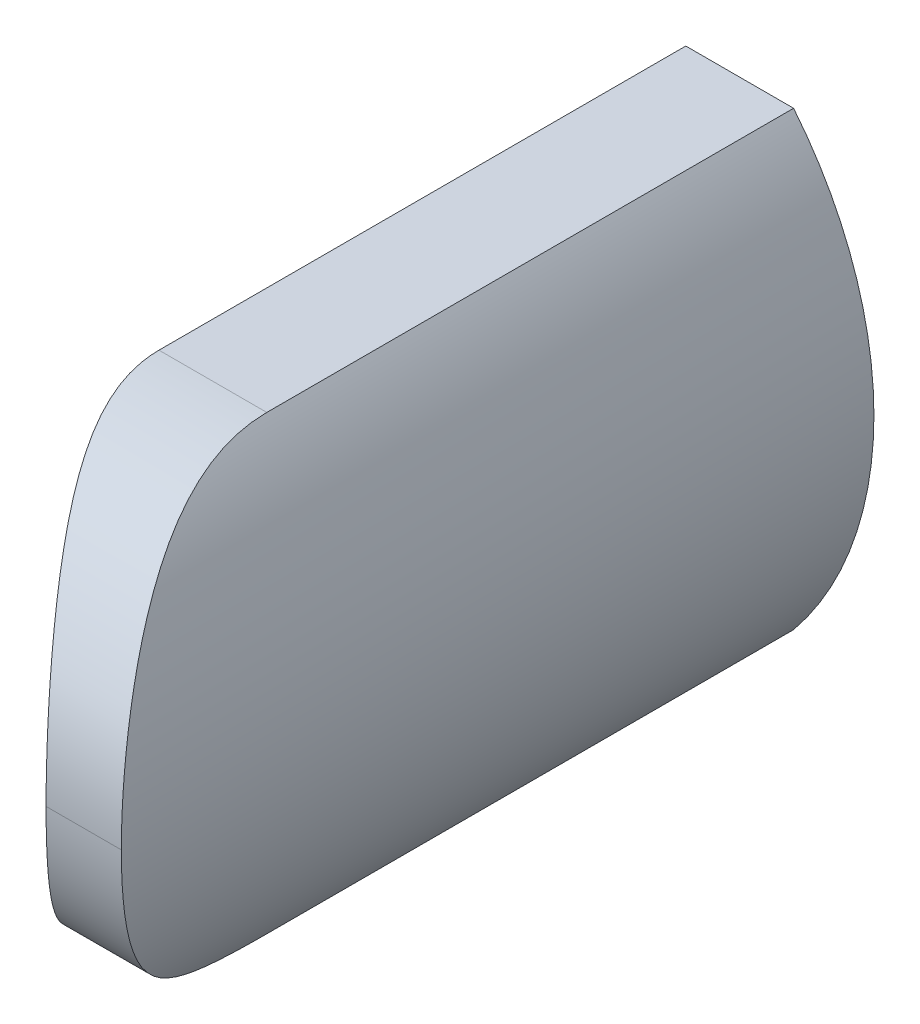
from build123d import *

# Parameters (mm, degrees)
BOSS_EXTRU_1_DEPTH = 100
CONG_1_R           = 30


with BuildPart() as part:
    # Esquisse1 → Boss.-Extru.1 (new body)
    with BuildSketch(Plane.XY):
        with BuildLine():
            Line((36.827299657, 30), (22.5, 30))
            ThreePointArc((22.5, 30), (33.541019662, 16.770509831), (37.5, 0))
            ThreePointArc((37.5, 0), (33.541019662, -16.770509831), (22.5, -30))
            Line((22.5, -30), (36.827299657, -30))
            ThreePointArc((36.827299657, -30), (44.752355992, -15.920949505), (47.5, 0))
            ThreePointArc((47.5, 0), (44.752355992, 15.920949505), (36.827299657, 30))
        make_face()
    extrude(amount=BOSS_EXTRU_1_DEPTH)

    # Congé1
    # the kernel refuses this fillet: 30 mm, written as the material it takes off along each edge
    with BuildSketch(Plane(origin=(111.827299657, 30, 100), x_dir=(0, 0, -1), z_dir=(-1, 0, 0))) as cong_1_piece_1:
        with BuildLine():
            CenterArc((CONG_1_R, CONG_1_R), CONG_1_R, 180, 90)
            Line((0, CONG_1_R), (0, 0))
            Line((0, 0), (CONG_1_R, 0))
        make_face()
    extrude(amount=164.327299657, mode=Mode.SUBTRACT)
    with BuildSketch(Plane(origin=(-52.5, -30, 100), x_dir=(0, 1, 0), z_dir=(1, 0, 0))) as cong_1_piece_2:
        with BuildLine():
            CenterArc((CONG_1_R, -CONG_1_R), CONG_1_R, 90, 90)
            Line((0, -CONG_1_R), (0, 0))
            Line((0, 0), (CONG_1_R, 0))
        make_face()
    extrude(amount=164.327299657, mode=Mode.SUBTRACT)


solid = part.part
